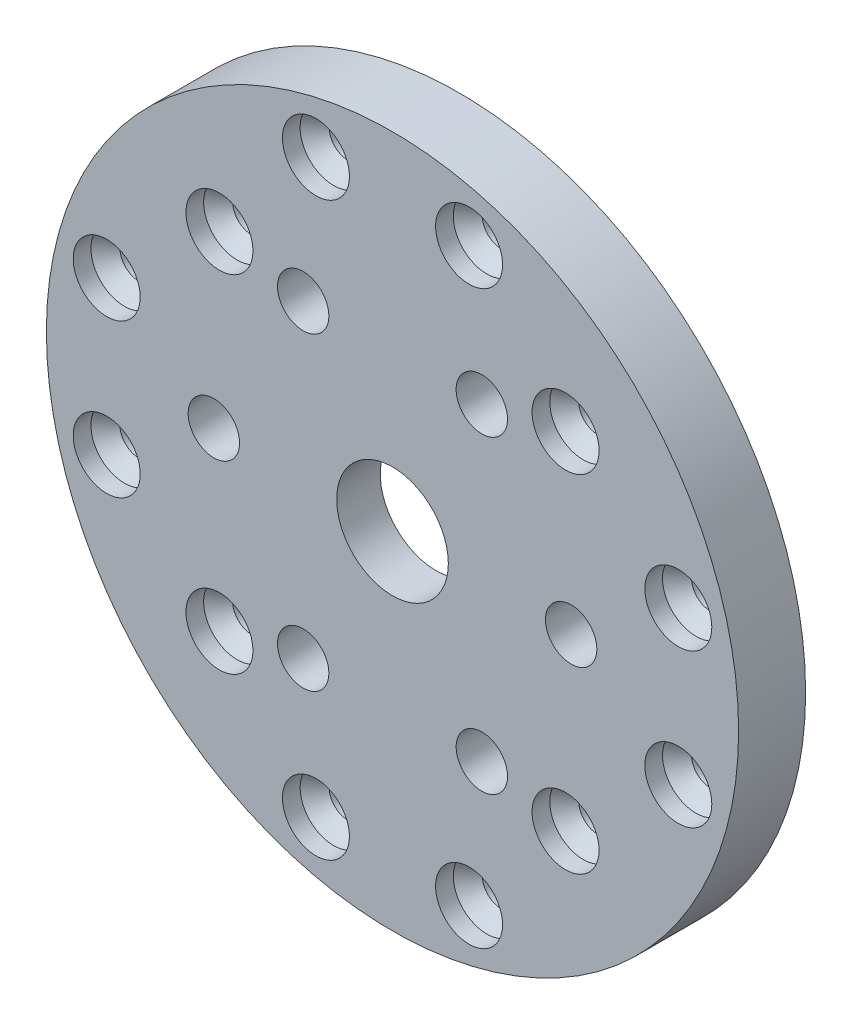
from build123d import *

# Parameters (mm, degrees)
SKETCH2_R           = 31
SKETCH2_R_2         = 11.1
SKETCH2_R_3         = 3
BOSS_EXTRUDE1_DEPTH = 6
BOSS_EXTRUDE3_START = -3.9
SKETCH4_R           = 11.1
SKETCH4_R_2         = 5
BOSS_EXTRUDE3_DEPTH = 3.9
SKETCH5_R           = 2.3
CUT_EXTRUDE1_DEPTH  = 6
CIRPATTERN3_COUNT   = 4
CUT_EXTRUDE2_REACH  = 101.674
SKETCH12_R          = 3
CIRPATTERN4_COUNT   = 2
CIRPATTERN4_ANGLE   = 60
CIRPATTERN5_COUNT   = 4


# Read off the part's stored shape, not the designer's step: Revolve1
with BuildPart() as part:
    # Sketch2 → Boss-Extrude1 (new body)
    with BuildSketch(Plane(origin=(-62.154924708, 3.943558292, 10.8), x_dir=(1, 0, 0), z_dir=(0, 0, 1))):
        Circle(SKETCH2_R)
        Circle(SKETCH2_R_2, mode=Mode.SUBTRACT)
        with Locations((-15.5, 15.5)):
            Circle(SKETCH2_R_3, mode=Mode.SUBTRACT)
        with Locations((15.5, 15.5)):
            Circle(SKETCH2_R_3, mode=Mode.SUBTRACT)
        with Locations((15.5, -15.5)):
            Circle(SKETCH2_R_3, mode=Mode.SUBTRACT)
        with Locations((-15.5, -15.5)):
            Circle(SKETCH2_R_3, mode=Mode.SUBTRACT)
    extrude(amount=BOSS_EXTRUDE1_DEPTH)

    # Sketch4 → Boss-Extrude3 (add)
    with BuildSketch(Plane(origin=(-62.154924708, 3.943558292, 16.8), x_dir=(1, 0, 0), z_dir=(0, 0, 1)).offset(BOSS_EXTRUDE3_START)):
        Circle(SKETCH4_R)
        Circle(SKETCH4_R_2, mode=Mode.SUBTRACT)
    extrude(amount=BOSS_EXTRUDE3_DEPTH)

    # Sketch5 → Cut-Extrude1 (cut)
    with BuildSketch(Plane.XY.offset(16.8)):
        with Locations((-46.154924708, 3.943558292)):
            Circle(SKETCH5_R)
        with Locations((-54.154924708, -9.912848169)):
            Circle(SKETCH5_R)
        with Locations((-70.154924708, -9.912848169)):
            Circle(SKETCH5_R)
        with Locations((-78.154924708, 3.943558292)):
            Circle(SKETCH5_R)
        with Locations((-70.154924708, 17.799964752)):
            Circle(SKETCH5_R)
        with Locations((-54.154924708, 17.799964752)):
            Circle(SKETCH5_R)
    extrude(amount=-CUT_EXTRUDE1_DEPTH, mode=Mode.SUBTRACT)

    # Revolve1 outline → Revolve1 (revolve)
    with BuildSketch(Plane(origin=(-77.654924708, 19.443558292, 0), x_dir=(1, 0, 0), z_dir=(0, -1, 0))):
        Polygon((1.7, 13.915), (1.7, 10.8), (3, 10.8), (3, 15.215), align=None)
    revolve1 = revolve(axis=Axis((-77.654924708, 19.443558292, 0), (0, 0, 1)))

    # CirPattern3: Revolve1 ×4 about axis
    cirpattern3_axis = Axis((-62.154924708, 3.943558292, 0), (0, 0, 1))
    for i in range(1, CIRPATTERN3_COUNT):
        add(revolve1.rotate(cirpattern3_axis, i * 360 / CIRPATTERN3_COUNT))

    # Sketch12 → Cut-Extrude2 (cut, up to next)
    with BuildSketch(Plane(origin=(0, 0, 10.8), x_dir=(-1, 0, 0), z_dir=(0, 0, -1)), mode=Mode.PRIVATE) as cut_extrude2_sk1:
        with Locations((69.013629403, -21.653476105)):
            Circle(SKETCH12_R)
    cut_extrude2_tool1 = extrude(cut_extrude2_sk1.sketch, amount=-CUT_EXTRUDE2_REACH, mode=Mode.PRIVATE) & part.part
    # Sketch12 → Cut-Extrude2 (cut, up to next)
    with BuildSketch(Plane(origin=(0, 0, 10.8), x_dir=(-1, 0, 0), z_dir=(0, 0, -1)), mode=Mode.PRIVATE) as cut_extrude2_sk2:
        with Locations(Location((55.296220013, -21.653476105, 0), (0, 0, 180))):
            Circle(SKETCH12_R)
    cut_extrude2_tool2 = extrude(cut_extrude2_sk2.sketch, amount=-CUT_EXTRUDE2_REACH, mode=Mode.PRIVATE) & part.part
    # Sketch12 → Cut-Extrude2 (cut, up to next)
    with BuildSketch(Plane(origin=(0, 0, 10.8), x_dir=(-1, 0, 0), z_dir=(0, 0, -1)), mode=Mode.PRIVATE) as cut_extrude2_sk3:
        with Locations(Location((36.557890311, 10.802262987, 0), (0, 0, 180))):
            Circle(SKETCH12_R)
    cut_extrude2_tool3 = extrude(cut_extrude2_sk3.sketch, amount=-CUT_EXTRUDE2_REACH, mode=Mode.PRIVATE) & part.part
    # Sketch12 → Cut-Extrude2 (cut, up to next)
    with BuildSketch(Plane(origin=(0, 0, 10.8), x_dir=(-1, 0, 0), z_dir=(0, 0, -1)), mode=Mode.PRIVATE) as cut_extrude2_sk4:
        with Locations((36.557890311, -2.915146404)):
            Circle(SKETCH12_R)
    cut_extrude2_tool4 = extrude(cut_extrude2_sk4.sketch, amount=-CUT_EXTRUDE2_REACH, mode=Mode.PRIVATE) & part.part
    # Sketch12 → Cut-Extrude2 (cut, up to next)
    with BuildSketch(Plane(origin=(0, 0, 10.8), x_dir=(-1, 0, 0), z_dir=(0, 0, -1)), mode=Mode.PRIVATE) as cut_extrude2_sk5:
        with Locations(Location((69.013629403, 29.540592688, 0), (0, 0, 180))):
            Circle(SKETCH12_R)
    cut_extrude2_tool5 = extrude(cut_extrude2_sk5.sketch, amount=-CUT_EXTRUDE2_REACH, mode=Mode.PRIVATE) & part.part
    # Sketch12 → Cut-Extrude2 (cut, up to next)
    with BuildSketch(Plane(origin=(0, 0, 10.8), x_dir=(-1, 0, 0), z_dir=(0, 0, -1)), mode=Mode.PRIVATE) as cut_extrude2_sk6:
        with Locations((55.296220013, 29.540592688)):
            Circle(SKETCH12_R)
    cut_extrude2_tool6 = extrude(cut_extrude2_sk6.sketch, amount=-CUT_EXTRUDE2_REACH, mode=Mode.PRIVATE) & part.part
    # Sketch12 → Cut-Extrude2 (cut, up to next)
    with BuildSketch(Plane(origin=(0, 0, 10.8), x_dir=(-1, 0, 0), z_dir=(0, 0, -1)), mode=Mode.PRIVATE) as cut_extrude2_sk7:
        with Locations(Location((87.751959105, -2.915146404, 0), (0, 0, 180))):
            Circle(SKETCH12_R)
    cut_extrude2_tool7 = extrude(cut_extrude2_sk7.sketch, amount=-CUT_EXTRUDE2_REACH, mode=Mode.PRIVATE) & part.part
    # Sketch12 → Cut-Extrude2 (cut, up to next)
    with BuildSketch(Plane(origin=(0, 0, 10.8), x_dir=(-1, 0, 0), z_dir=(0, 0, -1)), mode=Mode.PRIVATE) as cut_extrude2_sk8:
        with Locations((87.751959105, 10.802262987)):
            Circle(SKETCH12_R)
    cut_extrude2_tool8 = extrude(cut_extrude2_sk8.sketch, amount=-CUT_EXTRUDE2_REACH, mode=Mode.PRIVATE) & part.part
    add(cut_extrude2_tool1.solids().sort_by_distance((-69.013629, -21.653476, 10.8))[0], mode=Mode.SUBTRACT)
    add(cut_extrude2_tool2.solids().sort_by_distance((-55.29622, -21.653476, 10.8))[0], mode=Mode.SUBTRACT)
    add(cut_extrude2_tool3.solids().sort_by_distance((-36.55789, 10.802263, 10.8))[0], mode=Mode.SUBTRACT)
    add(cut_extrude2_tool4.solids().sort_by_distance((-36.55789, -2.915146, 10.8))[0], mode=Mode.SUBTRACT)
    add(cut_extrude2_tool5.solids().sort_by_distance((-69.013629, 29.540593, 10.8))[0], mode=Mode.SUBTRACT)
    add(cut_extrude2_tool6.solids().sort_by_distance((-55.29622, 29.540593, 10.8))[0], mode=Mode.SUBTRACT)
    add(cut_extrude2_tool7.solids().sort_by_distance((-87.751959, -2.915146, 10.8))[0], mode=Mode.SUBTRACT)
    add(cut_extrude2_tool8.solids().sort_by_distance((-87.751959, 10.802263, 10.8))[0], mode=Mode.SUBTRACT)

    # Sketch18 → Revolve2 (revolve)
    with BuildSketch(Plane(origin=(-5.149480043, 19.218121154, 0), x_dir=(-0.9659258262890653, -0.25881904510253195, 0), z_dir=(0.25881904510253195, -0.9659258262890653, 0)), mode=Mode.PRIVATE) as revolve2_sk:
        Polygon((82.516379015, -10.8), (82.516379015, -15.215), (83.816379015, -13.915), (83.816379015, -10.8), align=None)
    revolve2 = revolve(revolve2_sk.sketch.rotate(Axis((-87.751959105, -2.915146404, 16.8), (0, 0, -1)), 15), axis=Axis((-87.751959105, -2.915146404, 16.8), (0, 0, -1)))

    # CirPattern4: Revolve2 ×2 about axis
    cirpattern4_axis = Axis((-62.154924708, 3.943558292, 0), (0, 0, 1))
    for i in range(1, CIRPATTERN4_COUNT):
        add(revolve2.rotate(cirpattern4_axis, i * CIRPATTERN4_ANGLE / (CIRPATTERN4_COUNT - 1)))

    # CirPattern5: Revolve2 ×4 about axis
    cirpattern5_axis = Axis((-62.154924708, 3.943558292, 0), (0, 0, -1))
    for i in range(1, CIRPATTERN5_COUNT):
        add(revolve2.rotate(cirpattern5_axis, i * 360 / CIRPATTERN5_COUNT))

    # CirPattern5 copy 1 sketch → CirPattern5 copy 1 (revolve)
    with BuildSketch(Plane(origin=(-5.149480043, -11.33100457, 0), x_dir=(-0.965925826289072, 0.2588190451025073, 0), z_dir=(-0.2588190451025073, -0.965925826289072, 0))):
        Polygon((82.516379015, -10.8), (82.516379015, -15.215), (83.816379015, -13.915), (83.816379015, -10.8), align=None)
    revolve(axis=Axis((-87.751959105, 10.802262987, 16.8), (0, 0, -1)))

    # CirPattern5 copy 2 sketch → CirPattern5 copy 2 (revolve)
    with BuildSketch(Plane(origin=(-77.42948757, -53.061886373, 0), x_dir=(0.2588190451025072, 0.965925826289072, 0), z_dir=(-0.965925826289072, 0.2588190451025072, 0))):
        Polygon((82.516379015, -10.8), (82.516379015, -15.215), (83.816379015, -13.915), (83.816379015, -10.8), align=None)
    revolve(axis=Axis((-55.296220013, 29.540592689, 16.8), (0, 0, -1)))

    # CirPattern5 copy 3 sketch → CirPattern5 copy 3 (revolve)
    with BuildSketch(Plane(origin=(-119.160369373, 19.218121154, 0), x_dir=(0.965925826289072, -0.25881904510250714, 0), z_dir=(0.25881904510250714, 0.965925826289072, 0))):
        Polygon((82.516379015, -10.8), (82.516379015, -15.215), (83.816379015, -13.915), (83.816379015, -10.8), align=None)
    revolve(axis=Axis((-36.557890311, -2.915146403, 16.8), (0, 0, -1)))


solid = part.part
